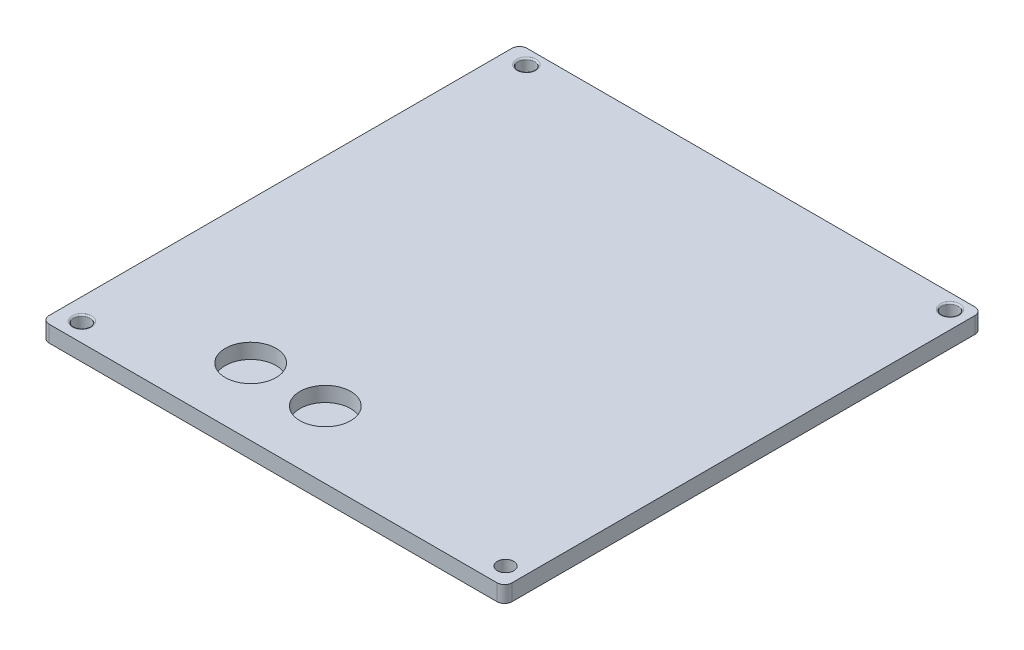
from build123d import *

# Parameters (mm, degrees)
SKETCH_1_W          = 62
SKETCH_1_H          = 64
EXTRUDE_1_DEPTH     = 2.2
SKETCH_2_R          = 3.4
CUT_EXTRUDE_1_DEPTH = 2
SKETCH_3_R          = 1.1
CUT_EXTRUDE_2_DEPTH = 2
FILLET_2_R          = 0.2
FILLET_3_R          = 0.2
FILLET_4_R          = 0.2
FILLET_11_R         = 1
FILLET_12_R         = 1
FILLET_13_R         = 1
FILLET_14_R         = 1


with BuildPart() as part:
    # Эскиз1 → Бобышка-Вытянуть1 (new body)
    with BuildSketch(Plane(origin=(0, 0, 0), x_dir=(1, 0, 0), z_dir=(0, 1, 0))):
        Rectangle(SKETCH_1_W, SKETCH_1_H)
    extrude(amount=EXTRUDE_1_DEPTH)

    # Эскиз2 → Вырез-Вытянуть1 (cut)
    with BuildSketch(Plane(origin=(0, 2.2, 0), x_dir=(1, 0, 0), z_dir=(0, 1, 0))):
        with Locations((-12, -23)):
            Circle(SKETCH_2_R)
        with Locations((-2, -23)):
            Circle(SKETCH_2_R)
    extrude(amount=-CUT_EXTRUDE_1_DEPTH, mode=Mode.SUBTRACT)

    # Эскиз3 → Вырез-Вытянуть2 (cut)
    with BuildSketch(Plane(origin=(0, 2.2, 0), x_dir=(1, 0, 0), z_dir=(0, 1, 0))):
        with Locations((-28.119000267, 30.041370592)):
            Circle(SKETCH_3_R)
        with Locations((28.62564892, 30.041370592)):
            Circle(SKETCH_3_R)
        with Locations((-28.119000267, -29.48984619)):
            Circle(SKETCH_3_R)
        with Locations((28.62564892, -29.48984619)):
            Circle(SKETCH_3_R)
    extrude(amount=-CUT_EXTRUDE_2_DEPTH, mode=Mode.SUBTRACT)

    # Скругление2
    fillet_2_edges = [part.edges().sort_by_distance(p)[0] for p in [
        (-29.219000267, 2.2, -30.041370592),
    ]]
    fillet(fillet_2_edges, radius=FILLET_2_R)

    # Скругление3
    fillet_3_edges = [part.edges().sort_by_distance(p)[0] for p in [
        (27.52564892, 2.2, -30.041370592),
    ]]
    fillet(fillet_3_edges, radius=FILLET_3_R)

    # Скругление4
    fillet_4_edges = [part.edges().sort_by_distance(p)[0] for p in [
        (-29.219000267, 2.2, 29.48984619),
    ]]
    fillet(fillet_4_edges, radius=FILLET_4_R)

    # Скругление11
    fillet_11_edges = [part.edges().sort_by_distance(p)[0] for p in [
        (-31, 1.1, 32),
    ]]
    fillet(fillet_11_edges, radius=FILLET_11_R)

    # Скругление12
    fillet_12_edges = [part.edges().sort_by_distance(p)[0] for p in [
        (-31, 1.1, -32),
    ]]
    fillet(fillet_12_edges, radius=FILLET_12_R)

    # Скругление13
    fillet_13_edges = [part.edges().sort_by_distance(p)[0] for p in [
        (31, 1.1, -32),
    ]]
    fillet(fillet_13_edges, radius=FILLET_13_R)

    # Скругление14
    fillet_14_edges = [part.edges().sort_by_distance(p)[0] for p in [
        (31, 1.1, 32),
    ]]
    fillet(fillet_14_edges, radius=FILLET_14_R)


solid = part.part
